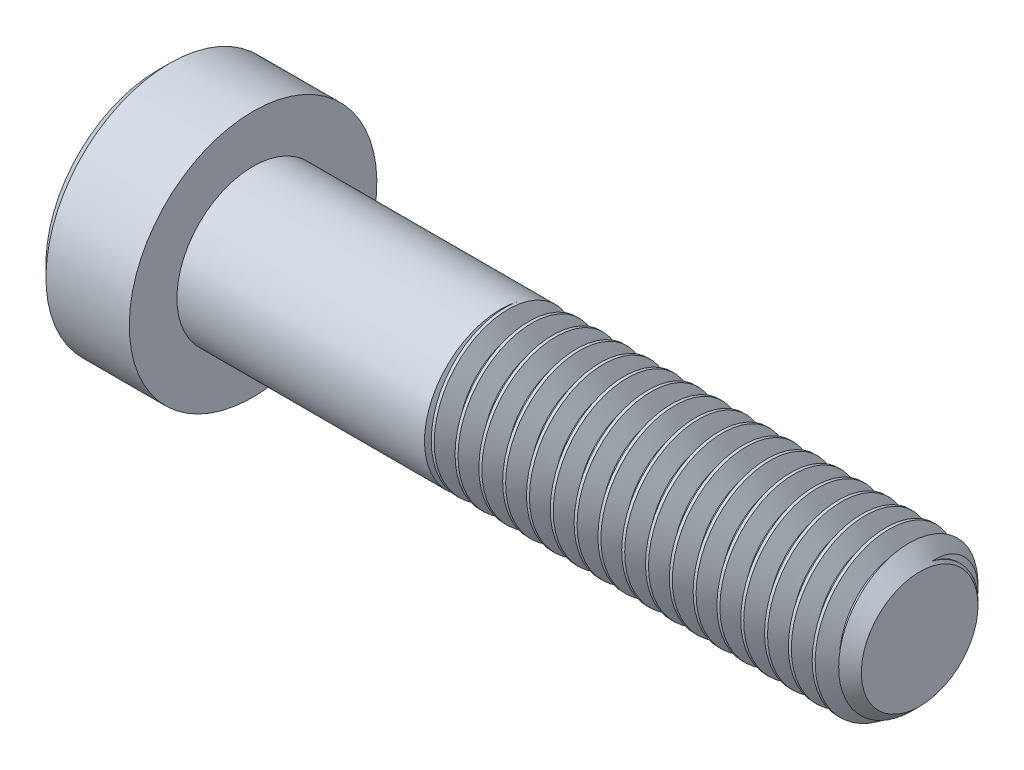
from build123d import *

# Parameters (mm, degrees)
SKETCH2_R           = 4
BOSS_EXTRUDE1_DEPTH = 22
CHAMFER1_SIZE       = 0.9375
CUT_SWEEP1_PITCH    = 1.25
CUT_EXTRUDE1_DEPTH  = 3.95


with BuildPart() as part:
    # Sketch2 → Boss-Extrude1 (new body)
    with BuildSketch(Plane(origin=(17.5, 0, 0), x_dir=(0, 0, -1), z_dir=(1, 0, 0))):
        Circle(SKETCH2_R)
    extrude(amount=-BOSS_EXTRUDE1_DEPTH)

    # Chamfer1
    chamfer1_edges = [part.edges().sort_by_distance(p)[0] for p in [
        (17.5, 0, 4),
    ]]
    chamfer(chamfer1_edges, length=CHAMFER1_SIZE)

    # Cut-Sweep1: the profile of Sketch5 profile screwed along a right-hand helix of 18.6 turns, 8 arcs to a turn; built about Z, then put on its axis
    cut_sweep1_z = Axis((0, 0, 0), (0, 0, 1))
    cut_sweep1_corners = [(4.0003, 0, 0.547048205), (4.0003, 0, -0.547048205), (3.188101184, 0, -0.078125), (3.188101184, 0, 0.078125)]
    with BuildLine(mode=Mode.PRIVATE) as cut_sweep1_profile:
        Line(cut_sweep1_corners[0], cut_sweep1_corners[1])
        Line(cut_sweep1_corners[1], cut_sweep1_corners[2])
        Line(cut_sweep1_corners[2], cut_sweep1_corners[3])
        Line(cut_sweep1_corners[3], cut_sweep1_corners[0])
    cut_sweep1_cap = Face(cut_sweep1_profile.wire())
    cut_sweep1_turn_angles = [0, 22.5, 45, 67.5, 90, 112.5, 135, 157.5, 180, 202.5, 225, 247.5, 270, 292.5, 315, 337.5, 360]
    cut_sweep1_turn_weights = [1, 0.9238795325112867, 1, 0.9238795325112867, 1, 0.9238795325112867, 1, 0.9238795325112867, 1, 0.9238795325112867, 1, 0.9238795325112867, 1, 0.9238795325112867, 1, 0.9238795325112867, 1]
    cut_sweep1_turn_rails = [Edge.make_bspline([Vector(p[0], p[1], 0).rotate(cut_sweep1_z, cut_sweep1_turn_angles[k]) / cut_sweep1_turn_weights[k] + Vector(0, 0, p[2] + CUT_SWEEP1_PITCH * cut_sweep1_turn_angles[k] / 360) for k in range(17)], [0, 0, 0, 1, 1, 2, 2, 3, 3, 4, 4, 5, 5, 6, 6, 7, 7, 8, 8, 8], 2, cut_sweep1_turn_weights) for p in cut_sweep1_corners]
    cut_sweep1_turn_sides = [Face.make_surface_from_curves(cut_sweep1_turn_rails[p[0]], cut_sweep1_turn_rails[p[1]]) for p in [(0, 1), (1, 2), (2, 3), (3, 0)]]
    cut_sweep1_last_angles = [6480, 6502.5, 6525, 6547.5, 6570, 6592.5, 6615, 6637.5, 6660, 6678, 6696]
    cut_sweep1_last_weights = [1, 0.9238795325112867, 1, 0.9238795325112867, 1, 0.9238795325112867, 1, 0.9238795325112867, 1, 0.9510565162950407, 1]
    cut_sweep1_last_rails = [Edge.make_bspline([Vector(p[0], p[1], 0).rotate(cut_sweep1_z, cut_sweep1_last_angles[k]) / cut_sweep1_last_weights[k] + Vector(0, 0, p[2] + CUT_SWEEP1_PITCH * cut_sweep1_last_angles[k] / 360) for k in range(11)], [0, 0, 0, 1, 1, 2, 2, 3, 3, 4, 4, 5, 5, 5], 2, cut_sweep1_last_weights) for p in cut_sweep1_corners]
    cut_sweep1_last_sides = [Face.make_surface_from_curves(cut_sweep1_last_rails[p[0]], cut_sweep1_last_rails[p[1]]) for p in [(0, 1), (1, 2), (2, 3), (3, 0)]]
    cut_sweep1 = Plane(origin=(17.5, 0, 0), x_dir=(0, 1, 0), z_dir=(-1, 0, 0)) * Solid(Shell([*[p.moved(Location((0, 0, CUT_SWEEP1_PITCH * i))) for i in range(18) for p in cut_sweep1_turn_sides], *cut_sweep1_last_sides, cut_sweep1_cap, cut_sweep1_cap.rotate(cut_sweep1_z, 6696).moved(Location((0, 0, CUT_SWEEP1_PITCH * 6696 / 360)))]))
    add(cut_sweep1, mode=Mode.SUBTRACT)

    # Sketch10 → Revolve2 (revolve)
    with BuildSketch(Plane.XY, mode=Mode.PRIVATE) as revolve2_sk:
        Polygon((-2.190598923, 0), (-4.5, 4), (-17.5, 4), (-17.5, 0), align=None)
    revolve(revolve2_sk.sketch.rotate(Axis((-17.5, 0, 0), (1, 0, 0)), 270), axis=Axis((-17.5, 0, 0), (1, 0, 0)))

    # Sketch6 → Revolve1 (revolve)
    with BuildSketch(Plane.XY, mode=Mode.PRIVATE) as revolve1_sk:
        Polygon((-21.875, 6.5), (-22.5, 5.875), (-22.5, 0), (-17.5, 0), (-17.5, 6.5), align=None)
    revolve(revolve1_sk.sketch.rotate(Axis((-17.5, 0, 0), (-1, 0, 0)), 90), axis=Axis((-17.5, 0, 0), (-1, 0, 0)))

    # Sketch4 → Cut-Extrude1 (cut)
    with BuildSketch(Plane(origin=(-22.5, 0, 0), x_dir=(0, 0, -1), z_dir=(1, 0, 0))):
        Polygon((0, 2.886751346), (-2.5, 1.443375673), (-2.5, -1.443375673), (0, -2.886751346), (2.5, -1.443375673), (2.5, 1.443375673), align=None)
    extrude(amount=CUT_EXTRUDE1_DEPTH, mode=Mode.SUBTRACT)

    # Cut-Extrude2 cone 1 section (through the dimple's axis) → Cut-Extrude2 (revolve, cut)
    with BuildSketch(Plane(origin=(-22.5, 0, 0), x_dir=(0, 0, 1), z_dir=(0, 1, 0))):
        Polygon((0, 0), (2.886751346, 0), (0, 2.886751346), align=None)
    revolve(axis=Axis((-22.5, 0, 0), (1, 0, 0)), mode=Mode.SUBTRACT)


solid = part.part
